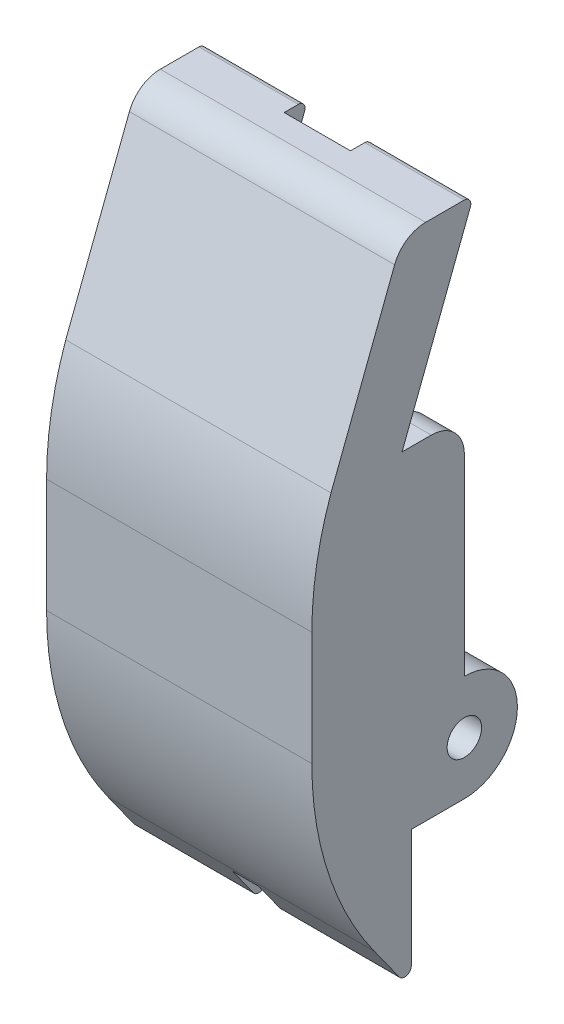
from build123d import *

# Parameters (mm, degrees)
BOSS_EXTRUDE5_DEPTH      = 20
BOSS_EXTRUDE5_DEPTH_BACK = 20
SKETCH6_R                = 2.6000000000000005
SKETCH7_W                = 30.000000000000004
SKETCH7_H                = 21
CUT_EXTRUDE1_DEPTH       = 16
BOSS_EXTRUDE6_DEPTH      = 18
BOSS_EXTRUDE7_DEPTH      = 4
SKETCH12_W               = 4.9999999999999964
SKETCH12_H               = 12.999999999999998
BOSS_EXTRUDE8_DEPTH      = 34
FILLET4_R                = 5
FILLET5_R                = 1
CUT_EXTRUDE3_START       = -15
CUT_EXTRUDE3_DEPTH       = 10
CUT_EXTRUDE4_DEPTH       = 3.360889535
FILLET7_R                = 5
FILLET8_R                = 50


with BuildPart() as part:
    # Sketch6 → Boss-Extrude5 (new, two sides: drawn at the far end of the back side and taken through both)
    with BuildSketch(Plane(origin=(0, 0, 0), x_dir=(0, 0, -1), z_dir=(1, 0, 0)).offset(-BOSS_EXTRUDE5_DEPTH_BACK)):
        with BuildLine():
            Line((-23, -8), (0, -8))
            ThreePointArc((0, -8), (8, 0), (0, 8))
            Line((0, 8), (-13, 7.999999999999998))
            Line((-13, 7.999999999999998), (-13, 42))
            Line((-13, 42), (-9.400224659785392, 42))
            Line((-9.400224659785392, 42), (1.4279133192728315, 70.2082638402405))
            Line((1.4279133192728315, 70.2082638402405), (-9.283536617097441, 70.2082638402405))
            Line((-9.283536617097441, 70.2082638402405), (-20.111674596155662, 42))
            Line((-20.111674596155662, 42), (-23, 42))
            Line((-23, 42), (-23, -8))
        make_face()
        Circle(SKETCH6_R, mode=Mode.SUBTRACT)
    extrude(amount=BOSS_EXTRUDE5_DEPTH + BOSS_EXTRUDE5_DEPTH_BACK)

    # Sketch7 → Cut-Extrude1 (cut)
    with BuildSketch(Plane(origin=(0, 8, 1.07e-15), x_dir=(1, 0, 0), z_dir=(0, 1, 0))):
        with Locations((0, -2.4999999999999982)):
            Rectangle(SKETCH7_W, SKETCH7_H)
    extrude(amount=-CUT_EXTRUDE1_DEPTH, mode=Mode.SUBTRACT)

    # Sketch9 → Boss-Extrude6 (add)
    with BuildSketch(Plane(origin=(20, 0, 0), x_dir=(0, 0, -1), z_dir=(1, 0, 0))):
        Polygon((-8, -8), (-7.9999999999999964, -28.890618944469697), (-23, -8), align=None)
    boss_extrude6 = extrude(amount=-BOSS_EXTRUDE6_DEPTH)

    # Mirror1: Boss-Extrude6 across plane
    add(boss_extrude6.mirror(Plane(origin=(0, 0, 0), x_dir=(0, 0, 1), z_dir=(1, 0, 0))))

    # Sketch10 → Boss-Extrude7 (add)
    with BuildSketch(Plane.ZY.offset(-2)):
        Polygon((23, -8), (13, -8), (13.000000000000004, -21.927079296313124), align=None)
    extrude(amount=BOSS_EXTRUDE7_DEPTH)

    # Sketch12 → Boss-Extrude8 (add)
    with BuildSketch(Plane(origin=(0, 8, 1.07e-15), x_dir=(1, 0, 0), z_dir=(0, 1, 1.3e-16))):
        with Locations((17.5, -6.499999999999999)):
            Rectangle(SKETCH12_W, SKETCH12_H)
    boss_extrude8 = extrude(amount=BOSS_EXTRUDE8_DEPTH)

    # Mirror2: Boss-Extrude8 across plane
    add(boss_extrude8.mirror(Plane(origin=(0, 0, 0), x_dir=(0, 0, 1), z_dir=(1, 0, 0))))

    # Fillet4
    fillet4_edges = [part.edges().sort_by_distance(p)[0] for p in [
        (2, -8, 10.5),
        (-2, -8, 10.5),
    ]]
    fillet(fillet4_edges, radius=FILLET4_R)

    # Fillet5
    fillet5_edges = [part.edges().sort_by_distance(p)[0] for p in [
        (0, 70.2082638402405, -1.4279133192728315),
        (11, -28.890618944469697, 7.9999999999999964),
        (-11, -28.890618944469697, 7.9999999999999964),
    ]]
    fillet(fillet5_edges, radius=FILLET5_R)

    # Sketch13 → Cut-Extrude3 (cut)
    with BuildSketch(Plane(origin=(20, 0, 0), x_dir=(0, 0, -1), z_dir=(1, 0, 0)).offset(CUT_EXTRUDE3_START)):
        Polygon((1.4279133192728315, 70.2082638402405), (-9.400224659785392, 42), (-13.00022465978539, 42), (-2.172086680727171, 70.2082638402405), align=None)
    extrude(amount=-CUT_EXTRUDE3_DEPTH, mode=Mode.SUBTRACT)

    # Sketch14 → Cut-Extrude4 (cut)
    with BuildSketch(Plane(origin=(0, 8.538947678230453, 22.2447192205509), x_dir=(-1, 0, 0), z_dir=(0, -0.3583679495452972, -0.9335804264972031))):
        Polygon((-15.000000000000004, 35.8416386762901), (-5.000000000000001, 48.794944027775955), (-5.000000000000001, 35.8416386762901), (-5.000000000000001, 34.55159456879367), (-15.000000000000004, 34.55159456879367), align=None)
    cut_extrude4 = extrude(amount=-CUT_EXTRUDE4_DEPTH, mode=Mode.SUBTRACT)

    # Mirror3: Cut-Extrude4 across plane
    add(cut_extrude4.mirror(Plane(origin=(0, 0, 0), x_dir=(0, 0, 1), z_dir=(1, 0, 0))), mode=Mode.SUBTRACT)

    # Fillet7
    fillet7_edges = [part.edges().sort_by_distance(p)[0] for p in [
        (17.5, 42, 5.6e-15),
        (-17.5, 42, 5.6e-15),
        (0, 70.2082638402405, 9.283536617097441),
        (5.000000000000001, 54.695169880241785, 6.3270055238869265),
        (-5.000000000000001, 54.695169880241785, 6.3270055238869265),
    ]]
    fillet(fillet7_edges, radius=FILLET7_R)

    # Fillet8
    # the kernel refuses this fillet: 50 mm, written as the material it takes off along each edge
    with BuildSketch(Plane(origin=(61.869597916190855, 42, 23), x_dir=(0, 0, -1), z_dir=(-1, 0, 0))) as fillet8_piece_1:
        with BuildLine():
            CenterArc((50, 16.747839166469827), FILLET8_R, 180, 19.569909983271373)
            Line((0, 16.747839166469827), (-1, 16.747839166469827))
            Line((-1, 16.747839166469827), (-1, 0))
            Line((-1, 0), (0, -1))
            ThreePointArc((0, -1), (1.444162701922167, -1), (1.946091911921222, -0.33495678332939605))
            Line((1.946091911921222, -0.33495678332939605), (2.888325403844334, 0))
        make_face()
    extrude(amount=123.73919583238171, mode=Mode.SUBTRACT)
    with BuildSketch(Plane(origin=(-60.228570108654466, -8.000000000000004, 23), x_dir=(0, -0.812294131590468, -0.5832480122415225), z_dir=(1, 0, 0))) as fillet8_piece_2:
        with BuildLine():
            CenterArc((FILLET8_R * 0.321828560869, FILLET8_R), FILLET8_R, 234.32068370191269, 35.67931629808726)
            Line((-FILLET8_R * 0.261419451372, FILLET8_R * 0.18770586841), (-FILLET8_R * 0.273084411617, FILLET8_R * 0.171459985778))
            Line((-FILLET8_R * 0.273084411617, FILLET8_R * 0.171459985778), (-FILLET8_R * 0.00643657121738, -FILLET8_R * 0.02))
            Line((-FILLET8_R * 0.00643657121738, -FILLET8_R * 0.02), (FILLET8_R * 0.321828560869, -FILLET8_R * 0.02))
            Line((FILLET8_R * 0.321828560869, -FILLET8_R * 0.02), (FILLET8_R * 0.321828560869, 5e-16))
        make_face()
    extrude(amount=120.45714021730896, mode=Mode.SUBTRACT)


solid = part.part
